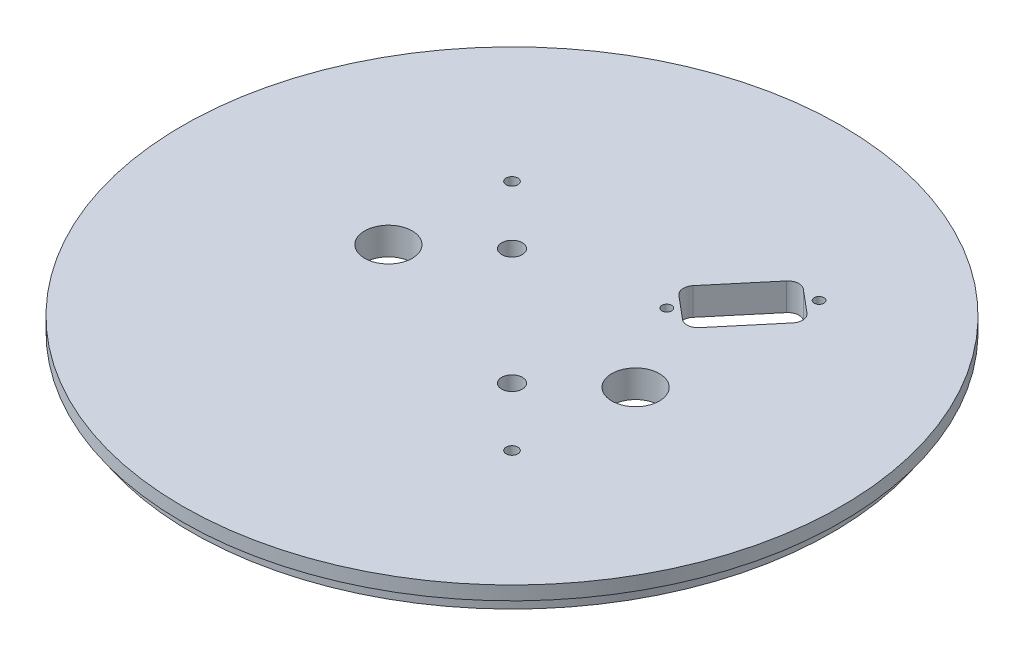
from build123d import *

# Parameters (mm, degrees)
SKETCH1_R                 = 76.2
SKETCH1_R_2               = 5.500000049
SKETCH1_R_3               = 1.3589
SKETCH1_R_4               = 2.38125
BOSS_EXTRUDE1_DEPTH       = 6.35
SKETCH2_R                 = 76.2
SKETCH2_R_2               = 74.041
CUT_EXTRUDE1_DEPTH        = 3.175
CUT_EXTRUDE2_START        = -5.969
CUT_EXTRUDE2_DEPTH        = 3.556
TAP_DRILL_FOR_4_40_TAP1_D = 2.2606
CUT_EXTRUDE3_DEPTH        = 108.95


with BuildPart() as part:
    # Sketch1 → Boss-Extrude1 (new body)
    with BuildSketch(Plane(origin=(0, 0, 0), x_dir=(1, 0, 0), z_dir=(0, 1, 0))):
        Circle(SKETCH1_R)
        with Locations((28.575, 0)):
            Circle(SKETCH1_R_2, mode=Mode.SUBTRACT)
        with Locations((-28.575, 0)):
            Circle(SKETCH1_R_2, mode=Mode.SUBTRACT)
        with Locations((-26.940768363, 26.940768363)):
            Circle(SKETCH1_R_3, mode=Mode.SUBTRACT)
        with Locations((26.940768363, -26.940768363)):
            Circle(SKETCH1_R_3, mode=Mode.SUBTRACT)
        with Locations((-13.470384182, 13.470384182)):
            Circle(SKETCH1_R_4, mode=Mode.SUBTRACT)
        with Locations((13.470384182, -13.470384182)):
            Circle(SKETCH1_R_4, mode=Mode.SUBTRACT)
    extrude(amount=BOSS_EXTRUDE1_DEPTH)

    # Sketch2 → Cut-Extrude1 (cut)
    with BuildSketch(Plane.XZ):
        Circle(SKETCH2_R)
        Circle(SKETCH2_R_2, mode=Mode.SUBTRACT)
    extrude(amount=-CUT_EXTRUDE1_DEPTH, mode=Mode.SUBTRACT)

    # Sketch3 → Cut-Extrude2 (cut)
    with BuildSketch(Plane(origin=(0, 6.35, 0), x_dir=(1, 0, 0), z_dir=(0, 1, 0)).offset(CUT_EXTRUDE2_START)):
        with BuildLine():
            Line((3.2385, 34.798), (3.2385, 13.97))
            ThreePointArc((3.2385, 13.97), (0, 10.7315), (-3.2385, 13.97))
            Line((-3.2385, 13.97), (-3.2385, 34.798))
            ThreePointArc((-3.2385, 34.798), (0, 38.0365), (3.2385, 34.798))
        make_face()
        with BuildLine():
            Line((3.2385, -34.798), (3.2385, -13.97))
            ThreePointArc((3.2385, -13.97), (0, -10.7315), (-3.2385, -13.97))
            Line((-3.2385, -13.97), (-3.2385, -34.798))
            ThreePointArc((-3.2385, -34.798), (0, -38.0365), (3.2385, -34.798))
        make_face()
    extrude(amount=-CUT_EXTRUDE2_DEPTH, mode=Mode.SUBTRACT)

    # Tap Drill for #4-40 Tap1 (through all)
    with Locations(Plane(origin=(0, 6.35, 0), x_dir=(1, 0, 0), z_dir=(0, 1, 0))):
        with Locations((16.326805286, 19.457528855), (32.396495553, 38.608639962)):
            Hole(TAP_DRILL_FOR_4_40_TAP1_D / 2)

    # Sketch4 → Cut-Extrude3 (cut, through all)
    with BuildSketch(Plane(origin=(0, 6.35, 0), x_dir=(1, 0, 0), z_dir=(0, 1, 0))):
        with BuildLine():
            Line((15.169451366, 23.412825166), (20.422984157, 19.004587739))
            ThreePointArc((20.422984157, 19.004587739), (22.277040272, 18.420006091), (24.001417571, 19.317660095))
            Line((24.001417571, 19.317660095), (33.866921829, 31.074910238))
            ThreePointArc((33.866921829, 31.074910238), (34.451503477, 32.928966353), (33.553849472, 34.653343652))
            Line((33.553849472, 34.653343652), (28.300316681, 39.061581079))
            ThreePointArc((28.300316681, 39.061581079), (26.446260566, 39.646162727), (24.721883267, 38.748508722))
            Line((24.721883267, 38.748508722), (14.856379009, 26.99125858))
            ThreePointArc((14.856379009, 26.99125858), (14.271797362, 25.137202465), (15.169451366, 23.412825166))
        make_face()
    extrude(amount=-CUT_EXTRUDE3_DEPTH, mode=Mode.SUBTRACT)


solid = part.part
